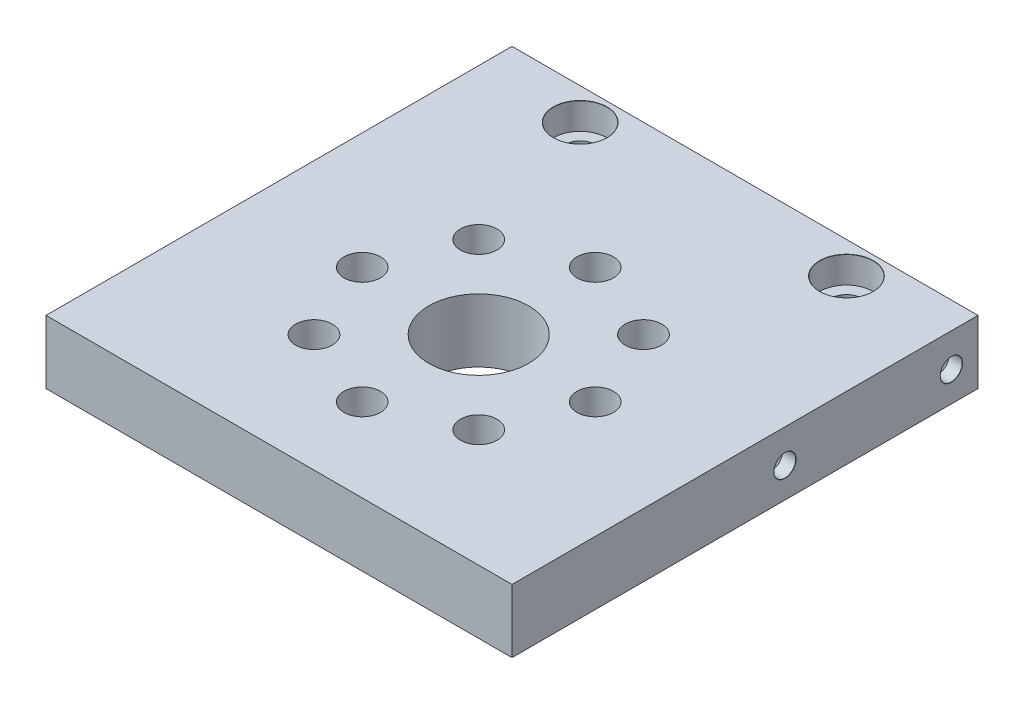
from build123d import *

# Parameters (mm, degrees)
SKETCH1_W                            = 70
SKETCH1_H                            = 70
BOSS_EXTRUDE1_DEPTH                  = 9.525
CBORE_FOR_M5_SHCS2_AT_2_COUNT        = 2
CBORE_FOR_M5_SHCS2_AT_2_PITCH        = 13.393920133
CBORE_FOR_M5_SHCS2_AT_3_COUNT        = 2
CBORE_FOR_M5_SHCS2_AT_3_PITCH        = 24.748737342
CBORE_FOR_M5_SHCS2_AT_4_COUNT        = 2
CBORE_FOR_M5_SHCS2_AT_4_PITCH        = 32.335783638
CBORE_FOR_M5_SHCS2_AT_5_COUNT        = 2
CBORE_FOR_M5_SHCS2_AT_5_PITCH        = 35
CBORE_FOR_M5_SHCS2_AT_6_COUNT        = 2
CBORE_FOR_M5_SHCS2_AT_6_PITCH        = 32.335783638
CBORE_FOR_M5_SHCS2_AT_7_COUNT        = 2
CBORE_FOR_M5_SHCS2_AT_7_PITCH        = 24.748737342
CBORE_FOR_M5_SHCS2_AT_8_COUNT        = 2
CBORE_FOR_M5_SHCS2_AT_8_PITCH        = 13.393920133
TAP_DRILL_FOR_M4X0_7_TAP1_AT_2_COUNT = 2
TAP_DRILL_FOR_M4X0_7_TAP1_AT_2_PITCH = 25
SKETCH9_R                            = 7.5
CUT_EXTRUDE1_DEPTH                   = 51.405611047
CBORE_FOR_M4_SHCS1_AT_2_COUNT        = 2
CBORE_FOR_M4_SHCS1_AT_2_PITCH        = 40


with BuildPart() as part:
    # Sketch1 → Boss-Extrude1 (new body)
    with BuildSketch(Plane(origin=(0, 0, 0), x_dir=(1, 0, 0), z_dir=(0, 1, 0))):
        Rectangle(SKETCH1_W, SKETCH1_H)
    extrude(amount=BOSS_EXTRUDE1_DEPTH)

    # Sketch4 → CBORE for M5 SHCS2 (revolve, cut)
    with BuildSketch(Plane(origin=(0, 0, 22.5), x_dir=(0, 0, -1), z_dir=(1, 0, 0))):
        Polygon((0, 0), (0, 9.525), (2.75, 9.525), (2.75, 5), (5, 5), (5, 0.025), (5.025, 0), align=None)
    cbore_for_m5_shcs2 = revolve(axis=Axis((0, -6.35, 22.5), (0, 1, 0)), mode=Mode.SUBTRACT)

    # CBORE for M5 SHCS2 at 2: CBORE for M5 SHCS2 ×2
    with Locations(*[Vector(0.9238795325112866, 0, -0.38268343236509006) * (i * CBORE_FOR_M5_SHCS2_AT_2_PITCH) for i in range(1, CBORE_FOR_M5_SHCS2_AT_2_COUNT)]):
        add(cbore_for_m5_shcs2, mode=Mode.SUBTRACT)

    # CBORE for M5 SHCS2 at 3: CBORE for M5 SHCS2 ×2
    with Locations(*[Vector(0.7071067811865475, 0, -0.7071067811865477) * (i * CBORE_FOR_M5_SHCS2_AT_3_PITCH) for i in range(1, CBORE_FOR_M5_SHCS2_AT_3_COUNT)]):
        add(cbore_for_m5_shcs2, mode=Mode.SUBTRACT)

    # CBORE for M5 SHCS2 at 4: CBORE for M5 SHCS2 ×2
    with Locations(*[Vector(0.3826834323650898, 0, -0.9238795325112868) * (i * CBORE_FOR_M5_SHCS2_AT_4_PITCH) for i in range(1, CBORE_FOR_M5_SHCS2_AT_4_COUNT)]):
        add(cbore_for_m5_shcs2, mode=Mode.SUBTRACT)

    # CBORE for M5 SHCS2 at 5: CBORE for M5 SHCS2 ×2
    with Locations(*[(0, 0, -i * CBORE_FOR_M5_SHCS2_AT_5_PITCH) for i in range(1, CBORE_FOR_M5_SHCS2_AT_5_COUNT)]):
        add(cbore_for_m5_shcs2, mode=Mode.SUBTRACT)

    # CBORE for M5 SHCS2 at 6: CBORE for M5 SHCS2 ×2
    with Locations(*[Vector(-0.3826834323650896, 0, -0.9238795325112868) * (i * CBORE_FOR_M5_SHCS2_AT_6_PITCH) for i in range(1, CBORE_FOR_M5_SHCS2_AT_6_COUNT)]):
        add(cbore_for_m5_shcs2, mode=Mode.SUBTRACT)

    # CBORE for M5 SHCS2 at 7: CBORE for M5 SHCS2 ×2
    with Locations(*[Vector(-0.7071067811865474, 0, -0.7071067811865477) * (i * CBORE_FOR_M5_SHCS2_AT_7_PITCH) for i in range(1, CBORE_FOR_M5_SHCS2_AT_7_COUNT)]):
        add(cbore_for_m5_shcs2, mode=Mode.SUBTRACT)

    # CBORE for M5 SHCS2 at 8: CBORE for M5 SHCS2 ×2
    with Locations(*[Vector(-0.9238795325112867, 0, -0.38268343236509) * (i * CBORE_FOR_M5_SHCS2_AT_8_PITCH) for i in range(1, CBORE_FOR_M5_SHCS2_AT_8_COUNT)]):
        add(cbore_for_m5_shcs2, mode=Mode.SUBTRACT)

    # Sketch8 → Tap Drill for M4x0.7 Tap1 (revolve, cut)
    with BuildSketch(Plane(origin=(35, 4.5, -6), x_dir=(0, 0, -1), z_dir=(0, 1, 0))):
        Polygon((0, 0), (0, 2.991420021), (1.65, 2), (1.65, 0.025), (1.675, 0), align=None)
    tap_drill_for_m4x0_7_tap1 = revolve(axis=Axis((41.35, 4.5, -6), (-1, 0, 0)), mode=Mode.SUBTRACT)

    # Tap Drill for M4x0.7 Tap1 at 2: Tap Drill for M4x0.7 Tap1 ×2
    with Locations(*[(0, 0, -i * TAP_DRILL_FOR_M4X0_7_TAP1_AT_2_PITCH) for i in range(1, TAP_DRILL_FOR_M4X0_7_TAP1_AT_2_COUNT)]):
        add(tap_drill_for_m4x0_7_tap1, mode=Mode.SUBTRACT)

    # Sketch9 → Cut-Extrude1 (cut, through all)
    with BuildSketch(Plane.XZ):
        with Locations((0, 5)):
            Circle(SKETCH9_R)
    extrude(amount=-CUT_EXTRUDE1_DEPTH, mode=Mode.SUBTRACT)

    # Sketch15 → CBORE for M4 SHCS1 (revolve, cut)
    with BuildSketch(Plane(origin=(-20, 9.525, -30.2375), x_dir=(0, 0, 1), z_dir=(1, 0, 0))):
        Polygon((0, 0), (0, 9.525), (2.25, 9.525), (2.25, 4), (4, 4), (4, 0.025), (4.025, 0), align=None)
    cbore_for_m4_shcs1 = revolve(axis=Axis((-20, 15.875, -30.2375), (0, -1, 0)), mode=Mode.SUBTRACT)

    # CBORE for M4 SHCS1 at 2: CBORE for M4 SHCS1 ×2
    with Locations(*[(i * CBORE_FOR_M4_SHCS1_AT_2_PITCH, 0, 0) for i in range(1, CBORE_FOR_M4_SHCS1_AT_2_COUNT)]):
        add(cbore_for_m4_shcs1, mode=Mode.SUBTRACT)

    # Mirror1: Tap Drill for M4x0.7 Tap1 across plane
    add(tap_drill_for_m4x0_7_tap1.mirror(Plane(origin=(0, 0, 0), x_dir=(0, 0, 1), z_dir=(1, 0, 0))), mode=Mode.SUBTRACT)

    # Mirror1 copy 1 sketch → Mirror1 copy 1 (revolve, cut)
    with BuildSketch(Plane(origin=(-35, 4.5, -31), x_dir=(0, 0, -1), z_dir=(0, 1, 0))):
        Polygon((0, 0), (0, -2.991420021), (1.65, -2), (1.65, -0.025), (1.675, 0), align=None)
    revolve(axis=Axis((-41.35, 4.5, -31), (-1, 0, 0)), mode=Mode.SUBTRACT)


solid = part.part
